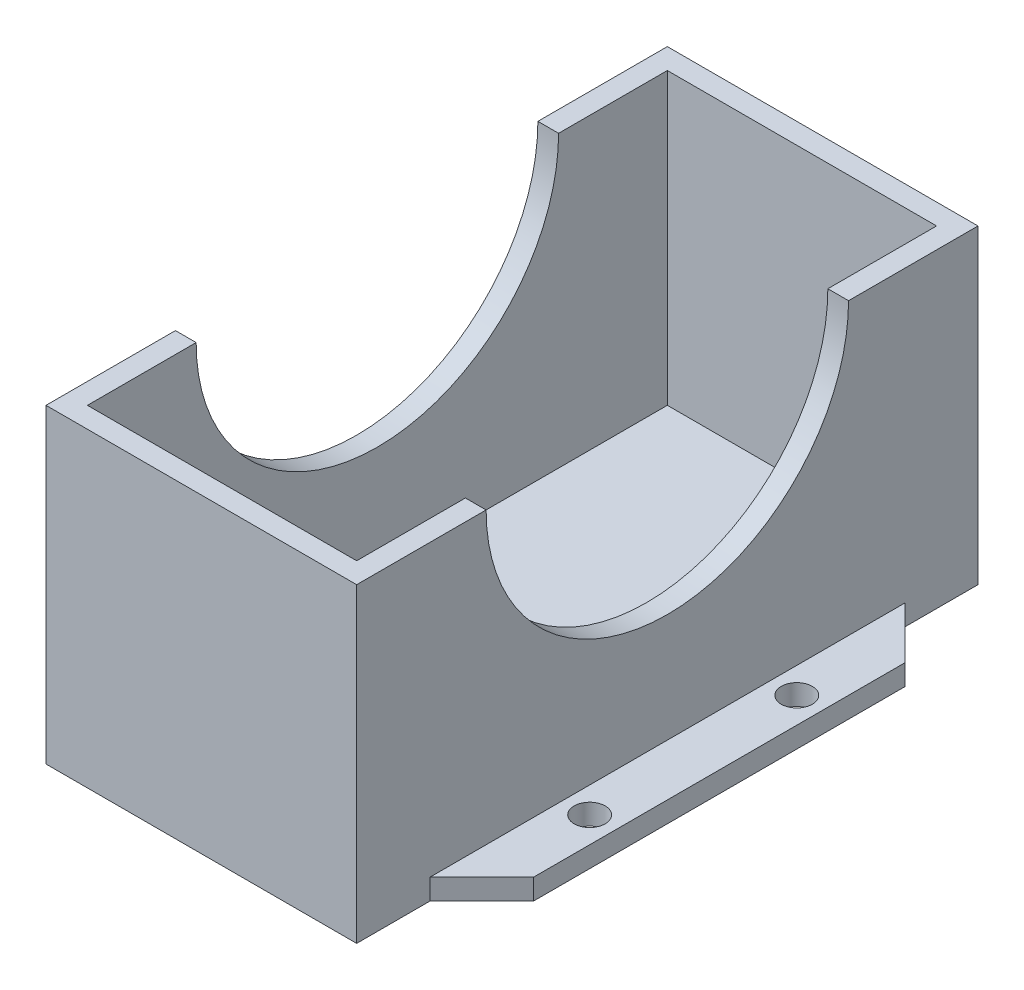
from build123d import *

# Parameters (mm, degrees)
SKETCH1_R           = 1.5
BOSS_EXTRUDE1_DEPTH = 2
SKETCH2_W           = 30
SKETCH2_H           = 60
SKETCH2_W_2         = 26
SKETCH2_H_2         = 56
BOSS_EXTRUDE2_DEPTH = 28
SKETCH3_R           = 17.5
CUT_EXTRUDE1_DEPTH  = 56


with BuildPart() as part:
    # Sketch1 → Boss-Extrude1 (new body)
    with BuildSketch(Plane(origin=(0, 0, 0), x_dir=(1, 0, 0), z_dir=(0, 1, 0))):
        Polygon((0, -30), (0, 30), (-15, 30), (-15, 22.928932188), (-20, 17.928932188), (-20, -17.928932188), (-15, -22.928932188), (-15, -30), align=None)
        with Locations((-17.5, 10)):
            Circle(SKETCH1_R, mode=Mode.SUBTRACT)
        with Locations((-17.5, -10)):
            Circle(SKETCH1_R, mode=Mode.SUBTRACT)
    boss_extrude1 = extrude(amount=BOSS_EXTRUDE1_DEPTH)

    # Mirror1: Boss-Extrude1 across plane
    add(boss_extrude1.mirror(Plane(origin=(0, 0, 0), x_dir=(0, 0, 1), z_dir=(1, 0, 0))))

    # Sketch2 → Boss-Extrude2 (add)
    with BuildSketch(Plane(origin=(0, 2, 0), x_dir=(1, 0, 0), z_dir=(0, 1, 0))):
        Rectangle(SKETCH2_W, SKETCH2_H)
        Rectangle(SKETCH2_W_2, SKETCH2_H_2, mode=Mode.SUBTRACT)
    extrude(amount=BOSS_EXTRUDE2_DEPTH)

    # Sketch3 → Cut-Extrude1 (cut, through all)
    with BuildSketch(Plane(origin=(15, 0, 0), x_dir=(0, 0, -1), z_dir=(1, 0, 0))):
        with Locations((0, 30)):
            Circle(SKETCH3_R)
    extrude(amount=-CUT_EXTRUDE1_DEPTH, mode=Mode.SUBTRACT)


solid = part.part
